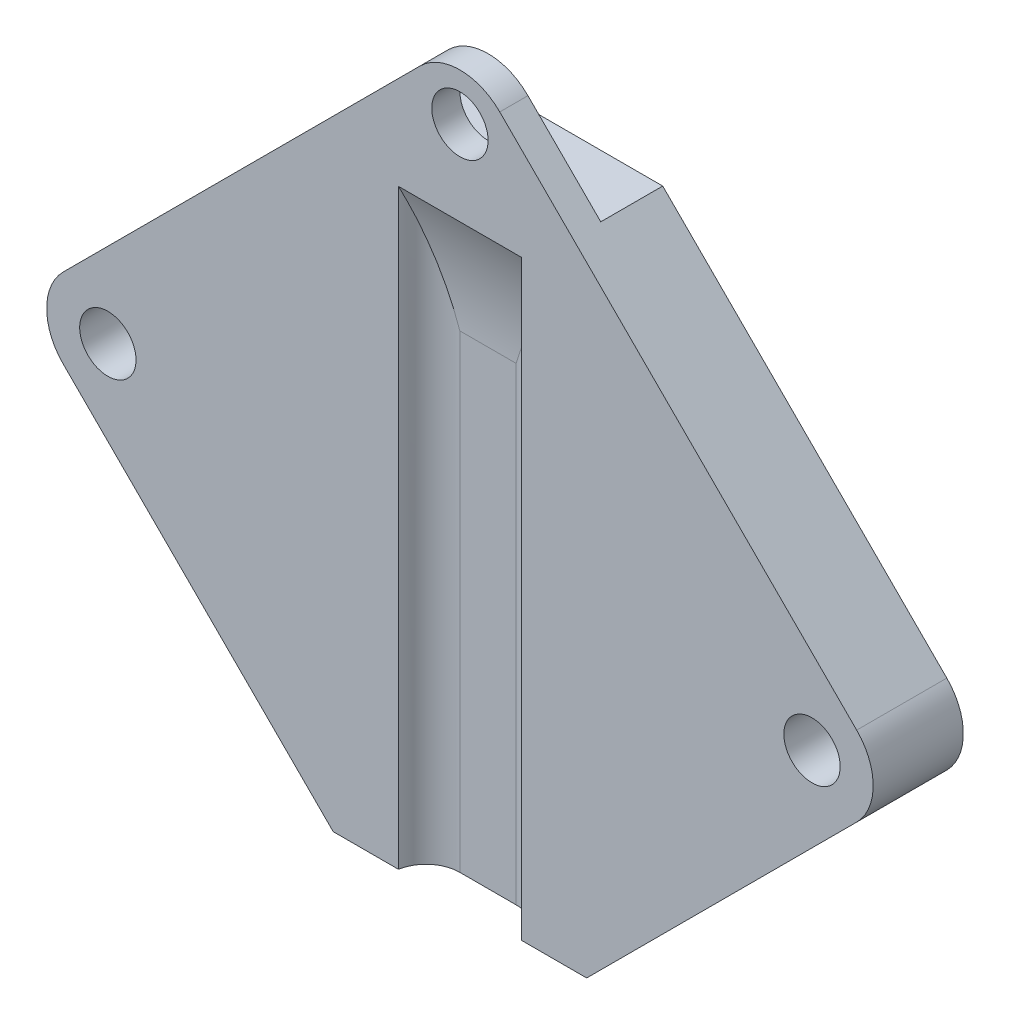
from build123d import *

# Parameters (mm, degrees)
SKETCH1_R           = 1
BOSS_EXTRUDE1_DEPTH = 3.2
CUT_EXTRUDE1_DEPTH  = 21
FILLET1_R           = 10
CUT_EXTRUDE3_DEPTH  = 2.2


with BuildPart() as part:
    # Sketch1 → Boss-Extrude1 (new body)
    with BuildSketch(Plane.XY):
        with BuildLine():
            Line((-13.537758799, -2.661648107), (-3.951972362, -12.247434544))
            Line((-3.951972362, -12.247434544), (5.048027638, -12.247434544))
            Line((5.048027638, -12.247434544), (14.633814076, -2.661648107))
            ThreePointArc((14.633814076, -2.661648107), (15.219600513, -1.247434544), (14.633814076, 0.166779018))
            Line((14.633814076, 0.166779018), (1.962241201, 12.838351893))
            ThreePointArc((1.962241201, 12.838351893), (0.548027638, 13.424138331), (-0.866185924, 12.838351893))
            Line((-0.866185924, 12.838351893), (-13.537758799, 0.166779018))
            ThreePointArc((-13.537758799, 0.166779018), (-14.123545237, -1.247434544), (-13.537758799, -2.661648107))
        make_face()
        with Locations((-11.951972362, -1.247434544)):
            Circle(SKETCH1_R, mode=Mode.SUBTRACT)
        with Locations((13.048027638, -1.247434544)):
            Circle(SKETCH1_R, mode=Mode.SUBTRACT)
        with Locations((0.548027638, 11.752565456)):
            Circle(SKETCH1_R, mode=Mode.SUBTRACT)
    extrude(amount=BOSS_EXTRUDE1_DEPTH)

    # Sketch2 → Cut-Extrude1 (cut)
    with BuildSketch(Plane.XZ.offset(12.247434544)):
        with BuildLine():
            Line((-0.451972362, 4.603907064), (1.548027638, 4.603907064))
            ThreePointArc((1.548027638, 4.603907064), (2.748027638, 3.403907064), (1.548027638, 2.203907064))
            Line((1.548027638, 2.203907064), (-0.451972362, 2.203907064))
            ThreePointArc((-0.451972362, 2.203907064), (-1.651972362, 3.403907064), (-0.451972362, 4.603907064))
        make_face()
    extrude(amount=-CUT_EXTRUDE1_DEPTH, mode=Mode.SUBTRACT)

    # Fillet1
    # the kernel refuses this fillet: 10 mm, written as the material it adds along each edge
    with BuildSketch(Plane(origin=(12.425084222, 8.752565456, 2.203907064), x_dir=(0, -1, 0), z_dir=(-1, 0, 0))) as fillet1_piece_1_section:
        with BuildLine():
            CenterArc((4.350822634, 10), FILLET1_R, 244.209471462, 25.790528538)
            Line((0, 0.996092936), (0, 0))
            Line((0, 0), (4.350822634, 0))
        make_face()
    fillet1_piece_1 = extrude(amount=23.754113168, mode=Mode.PRIVATE)
    fillet1_piece_1 = split(fillet1_piece_1, bisect_by=Plane(origin=(-2.713667021, 10.990870796, 2.436615037), z_dir=(0.7071067811865476, -0.7071067811865475, 0)), keep=Keep.TOP, mode=Mode.PRIVATE)
    fillet1_piece_1 = split(fillet1_piece_1, bisect_by=Plane(origin=(4.900996749, 9.899596345, 2.436615037), z_dir=(-0.7071067811865476, -0.7071067811865476, 0)), keep=Keep.TOP, mode=Mode.PRIVATE)
    add(fillet1_piece_1)

    # Sketch5 → Cut-Extrude3 (cut)
    with BuildSketch(Plane(origin=(0, 0, 0), x_dir=(-1, 0, 0), z_dir=(0, 0, -1))):
        Polygon((-4.548027638, 10.252565456), (-0.548027638, 14.252565456), (3.451972362, 10.252565456), align=None)
    extrude(amount=-CUT_EXTRUDE3_DEPTH, mode=Mode.SUBTRACT)


solid = part.part
